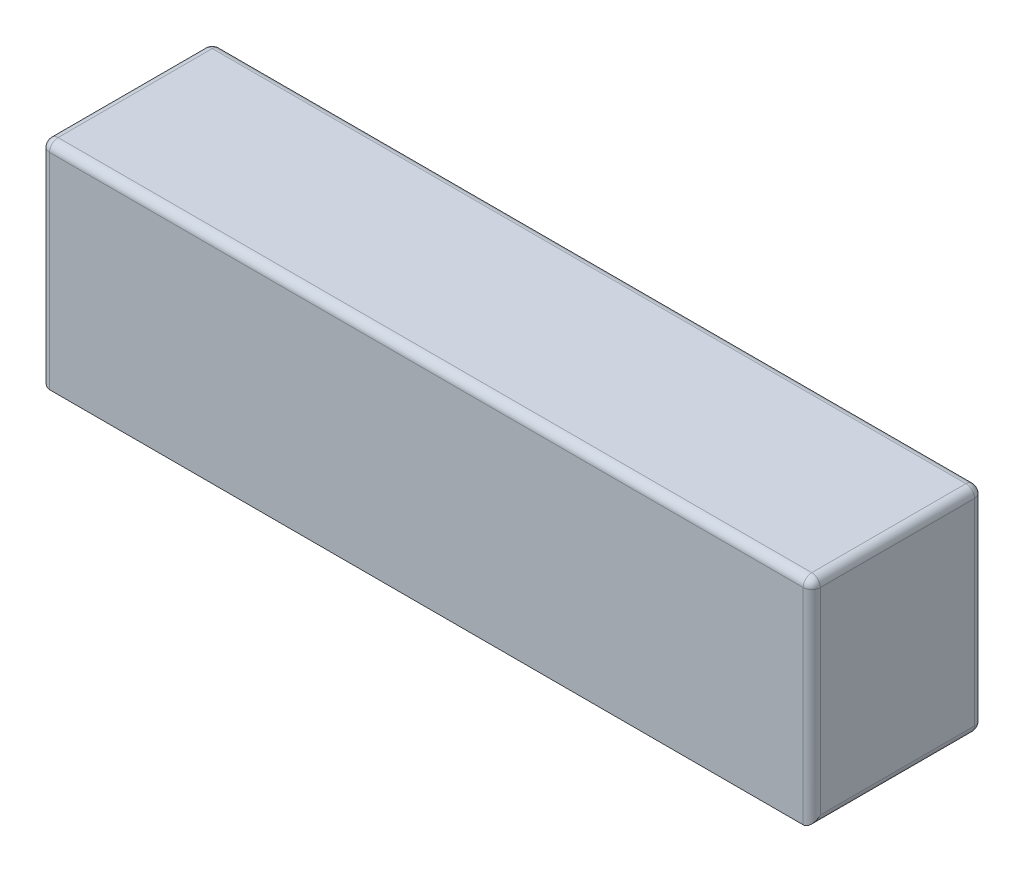
from build123d import *

# Parameters (mm, degrees)
SKETCH_1_W          = 90
SKETCH_1_H          = 25
EXTRUDE_1_DEPTH     = 20
SKETCH_4_W          = 42.246399656
SKETCH_4_H          = 21
CUT_EXTRUDE_2_DEPTH = 18
FILLET_5_R          = 1


with BuildPart() as part:
    # 草圖1 → 填料-伸長1 (new body)
    with BuildSketch(Plane.XY):
        with Locations((-36.268196215, -35.133707849)):
            Rectangle(SKETCH_1_W, SKETCH_1_H)
    extrude(amount=EXTRUDE_1_DEPTH)

    # 草圖4 → 除料-伸長2 (cut)
    with BuildSketch(Plane(origin=(0, 0, 0), x_dir=(-1, 0, 0), z_dir=(0, 0, -1))):
        with Locations((14.391396043, -35.133707849)):
            Rectangle(SKETCH_4_W, SKETCH_4_H)
        with Locations((58.144996387, -35.133707849)):
            Rectangle(SKETCH_4_W, SKETCH_4_H)
    extrude(amount=-CUT_EXTRUDE_2_DEPTH, mode=Mode.SUBTRACT)

    # 圓角5
    # the kernel refuses this fillet: 1 mm, written as the material it adds along each edge
    with BuildSketch(Plane(origin=(-78.268196215, -44.633707849, 17), x_dir=(-1, 0, 0), z_dir=(0, -1, 0))) as fillet_5_piece_1_section:
        Polygon((0, 0), (FILLET_5_R * 1.02, 0), (FILLET_5_R * 1.02, -FILLET_5_R * 1.02), (0, -FILLET_5_R * 1.02), align=None)
    fillet_5_piece_1 = extrude(amount=FILLET_5_R * 1.02, mode=Mode.PRIVATE)
    fillet_5_piece_1 = fillet_5_piece_1 - Plane(origin=(-78.268196215, -44.633707849, 17), x_dir=(0.7071067811865475, -1.914017473443079e-15, -0.7071067811865475), z_dir=(0, -1, 0)) * Sphere(FILLET_5_R, mode=Mode.PRIVATE)
    add(fillet_5_piece_1)
    with BuildSketch(Plane(origin=(6.731803785, -45.633707849, 0), x_dir=(-1, 0, 0), z_dir=(0, 0, 1)), Plane(origin=(-35.514595871, -24.633707849, 0), x_dir=(1, 0, 0), z_dir=(0, 0, 1)), Plane(origin=(-35.514595871, -45.633707849, 0), x_dir=(0, 1, 0), z_dir=(0, 0, 1)), Plane(origin=(-37.021796559, -45.633707849, 0), x_dir=(-1, 0, 0), z_dir=(0, 0, 1))) as fillet_5_piece_2:
        with BuildLine():
            CenterArc((FILLET_5_R, -FILLET_5_R), FILLET_5_R, 90, 90)
            Line((0, -FILLET_5_R), (-FILLET_5_R * 0.02, -FILLET_5_R))
            Line((-FILLET_5_R * 0.02, -FILLET_5_R), (-FILLET_5_R * 0.02, FILLET_5_R * 0.02))
            Line((-FILLET_5_R * 0.02, FILLET_5_R * 0.02), (FILLET_5_R, FILLET_5_R * 0.02))
            Line((FILLET_5_R, FILLET_5_R * 0.02), (FILLET_5_R, 0))
        make_face()
    extrude(amount=18)
    with BuildSketch(Plane(origin=(6.731803785, -24.633707849, 18), x_dir=(0, 0, -1), z_dir=(-1, 0, 0)), Plane(origin=(-35.514595871, -45.633707849, 18), x_dir=(0, 0, -1), z_dir=(1, 0, 0)), Plane(origin=(-37.021796559, -24.633707849, 18), x_dir=(0, 0, -1), z_dir=(-1, 0, 0))) as fillet_5_piece_3:
        with BuildLine():
            CenterArc((FILLET_5_R, FILLET_5_R), FILLET_5_R, 180, 90)
            Line((0, FILLET_5_R), (-FILLET_5_R * 0.02, FILLET_5_R))
            Line((-FILLET_5_R * 0.02, FILLET_5_R), (-FILLET_5_R * 0.02, -FILLET_5_R * 0.02))
            Line((-FILLET_5_R * 0.02, -FILLET_5_R * 0.02), (FILLET_5_R, -FILLET_5_R * 0.02))
            Line((FILLET_5_R, -FILLET_5_R * 0.02), (FILLET_5_R, 0))
        make_face()
    extrude(amount=42.246399656)
    with BuildSketch(Plane(origin=(6.731803785, -24.633707849, 0), x_dir=(-1, 0, 0), z_dir=(0, 0, 1))) as fillet_5_piece_4:
        with BuildLine():
            CenterArc((FILLET_5_R, FILLET_5_R), FILLET_5_R, 180, 90)
            Line((0, FILLET_5_R), (-FILLET_5_R * 0.02, FILLET_5_R))
            Line((-FILLET_5_R * 0.02, FILLET_5_R), (-FILLET_5_R * 0.02, -FILLET_5_R * 0.02))
            Line((-FILLET_5_R * 0.02, -FILLET_5_R * 0.02), (FILLET_5_R, -FILLET_5_R * 0.02))
            Line((FILLET_5_R, -FILLET_5_R * 0.02), (FILLET_5_R, 0))
        make_face()
    extrude(amount=18)
    with BuildSketch(Plane(origin=(-79.268196215, -24.633707849, 18), x_dir=(0, 0, -1), z_dir=(0, -1, 0))) as fillet_5_piece_5:
        with BuildLine():
            CenterArc((FILLET_5_R, FILLET_5_R), FILLET_5_R, 180, 90)
            Line((0, FILLET_5_R), (-FILLET_5_R * 0.02, FILLET_5_R))
            Line((-FILLET_5_R * 0.02, FILLET_5_R), (-FILLET_5_R * 0.02, -FILLET_5_R * 0.02))
            Line((-FILLET_5_R * 0.02, -FILLET_5_R * 0.02), (FILLET_5_R, -FILLET_5_R * 0.02))
            Line((FILLET_5_R, -FILLET_5_R * 0.02), (FILLET_5_R, 0))
        make_face()
    extrude(amount=20)
    with BuildSketch(Plane(origin=(-78.268196215, -45.633707849, 18), x_dir=(0, 0, -1), z_dir=(1, 0, 0))) as fillet_5_piece_6:
        with BuildLine():
            CenterArc((FILLET_5_R, FILLET_5_R), FILLET_5_R, 180, 90)
            Line((0, FILLET_5_R), (-FILLET_5_R * 0.02, FILLET_5_R))
            Line((-FILLET_5_R * 0.02, FILLET_5_R), (-FILLET_5_R * 0.02, -FILLET_5_R * 0.02))
            Line((-FILLET_5_R * 0.02, -FILLET_5_R * 0.02), (FILLET_5_R, -FILLET_5_R * 0.02))
            Line((FILLET_5_R, -FILLET_5_R * 0.02), (FILLET_5_R, 0))
        make_face()
    extrude(amount=41.246399656)
    with BuildSketch(Plane(origin=(-79.268196215, -45.633707849, 0), x_dir=(1, 0, 0), z_dir=(0, 0, 1))) as fillet_5_piece_7:
        with BuildLine():
            CenterArc((FILLET_5_R, FILLET_5_R), FILLET_5_R, 180, 90)
            Line((0, FILLET_5_R), (-FILLET_5_R * 0.02, FILLET_5_R))
            Line((-FILLET_5_R * 0.02, FILLET_5_R), (-FILLET_5_R * 0.02, -FILLET_5_R * 0.02))
            Line((-FILLET_5_R * 0.02, -FILLET_5_R * 0.02), (FILLET_5_R, -FILLET_5_R * 0.02))
            Line((FILLET_5_R, -FILLET_5_R * 0.02), (FILLET_5_R, 0))
        make_face()
    extrude(amount=17)
    with BuildSketch(Plane(origin=(6.731803785, -45.633707849, 0), x_dir=(-1, 0, 0), z_dir=(0, 0, 1))) as fillet_5_piece_8a_section:
        with BuildLine():
            CenterArc((FILLET_5_R, -FILLET_5_R), FILLET_5_R, 90, 90)
            Line((0, -FILLET_5_R), (-FILLET_5_R * 0.02, -FILLET_5_R))
            Line((-FILLET_5_R * 0.02, -FILLET_5_R), (-FILLET_5_R * 0.02, FILLET_5_R * 0.02))
            Line((-FILLET_5_R * 0.02, FILLET_5_R * 0.02), (FILLET_5_R, FILLET_5_R * 0.02))
            Line((FILLET_5_R, FILLET_5_R * 0.02), (FILLET_5_R, 0))
        make_face()
    fillet_5_piece_8a = extrude(amount=20.5, mode=Mode.PRIVATE)
    fillet_5_piece_8a = split(fillet_5_piece_8a, bisect_by=Plane(origin=(6.505408671, -45.407312734, 18), z_dir=(0, 0, 1)), keep=Keep.TOP, mode=Mode.PRIVATE)
    with BuildSketch(Plane(origin=(-35.514595871, -45.633707849, 18), x_dir=(0, 0, -1), z_dir=(1, 0, 0))) as fillet_5_piece_8b_section:
        with BuildLine():
            CenterArc((FILLET_5_R, FILLET_5_R), FILLET_5_R, 180, 90)
            Line((0, FILLET_5_R), (-FILLET_5_R * 0.02, FILLET_5_R))
            Line((-FILLET_5_R * 0.02, FILLET_5_R), (-FILLET_5_R * 0.02, -FILLET_5_R * 0.02))
            Line((-FILLET_5_R * 0.02, -FILLET_5_R * 0.02), (FILLET_5_R, -FILLET_5_R * 0.02))
            Line((FILLET_5_R, -FILLET_5_R * 0.02), (FILLET_5_R, 0))
        make_face()
    fillet_5_piece_8b = extrude(amount=44.746399656, mode=Mode.PRIVATE)
    fillet_5_piece_8b = split(fillet_5_piece_8b, bisect_by=Plane(origin=(6.731803785, -45.407312734, 17.773604886), z_dir=(1, 0, 0)), keep=Keep.TOP, mode=Mode.PRIVATE)
    fillet_5_piece_8 = fillet_5_piece_8a & fillet_5_piece_8b
    add(fillet_5_piece_8)
    with BuildSketch(Plane(origin=(6.731803785, -24.633707849, 0), x_dir=(-1, 0, 0), z_dir=(0, 0, 1))) as fillet_5_piece_9a_section:
        with BuildLine():
            CenterArc((FILLET_5_R, FILLET_5_R), FILLET_5_R, 180, 90)
            Line((0, FILLET_5_R), (-FILLET_5_R * 0.02, FILLET_5_R))
            Line((-FILLET_5_R * 0.02, FILLET_5_R), (-FILLET_5_R * 0.02, -FILLET_5_R * 0.02))
            Line((-FILLET_5_R * 0.02, -FILLET_5_R * 0.02), (FILLET_5_R, -FILLET_5_R * 0.02))
            Line((FILLET_5_R, -FILLET_5_R * 0.02), (FILLET_5_R, 0))
        make_face()
    fillet_5_piece_9a = extrude(amount=20.5, mode=Mode.PRIVATE)
    fillet_5_piece_9a = split(fillet_5_piece_9a, bisect_by=Plane(origin=(6.505408671, -24.860102963, 18), z_dir=(0, 0, 1)), keep=Keep.TOP, mode=Mode.PRIVATE)
    with BuildSketch(Plane(origin=(9.231803785, -24.633707849, 18), x_dir=(0, 0, -1), z_dir=(-1, 0, 0))) as fillet_5_piece_9b_section:
        with BuildLine():
            CenterArc((FILLET_5_R, FILLET_5_R), FILLET_5_R, 180, 90)
            Line((0, FILLET_5_R), (-FILLET_5_R * 0.02, FILLET_5_R))
            Line((-FILLET_5_R * 0.02, FILLET_5_R), (-FILLET_5_R * 0.02, -FILLET_5_R * 0.02))
            Line((-FILLET_5_R * 0.02, -FILLET_5_R * 0.02), (FILLET_5_R, -FILLET_5_R * 0.02))
            Line((FILLET_5_R, -FILLET_5_R * 0.02), (FILLET_5_R, 0))
        make_face()
    fillet_5_piece_9b = extrude(amount=44.746399656, mode=Mode.PRIVATE)
    fillet_5_piece_9b = split(fillet_5_piece_9b, bisect_by=Plane(origin=(6.731803785, -24.860102963, 17.773604886), z_dir=(1, 0, 0)), keep=Keep.TOP, mode=Mode.PRIVATE)
    fillet_5_piece_9 = fillet_5_piece_9a & fillet_5_piece_9b
    add(fillet_5_piece_9)
    with BuildSketch(Plane(origin=(-35.514595871, -24.633707849, 0), x_dir=(1, 0, 0), z_dir=(0, 0, 1))) as fillet_5_piece_10a_section:
        with BuildLine():
            CenterArc((FILLET_5_R, -FILLET_5_R), FILLET_5_R, 90, 90)
            Line((0, -FILLET_5_R), (-FILLET_5_R * 0.02, -FILLET_5_R))
            Line((-FILLET_5_R * 0.02, -FILLET_5_R), (-FILLET_5_R * 0.02, FILLET_5_R * 0.02))
            Line((-FILLET_5_R * 0.02, FILLET_5_R * 0.02), (FILLET_5_R, FILLET_5_R * 0.02))
            Line((FILLET_5_R, FILLET_5_R * 0.02), (FILLET_5_R, 0))
        make_face()
    fillet_5_piece_10a = extrude(amount=20.5, mode=Mode.PRIVATE)
    fillet_5_piece_10a = split(fillet_5_piece_10a, bisect_by=Plane(origin=(-35.288200757, -24.860102963, 18), z_dir=(0, 0, 1)), keep=Keep.TOP, mode=Mode.PRIVATE)
    with BuildSketch(Plane(origin=(6.731803785, -24.633707849, 18), x_dir=(0, 0, -1), z_dir=(-1, 0, 0))) as fillet_5_piece_10b_section:
        with BuildLine():
            CenterArc((FILLET_5_R, FILLET_5_R), FILLET_5_R, 180, 90)
            Line((0, FILLET_5_R), (-FILLET_5_R * 0.02, FILLET_5_R))
            Line((-FILLET_5_R * 0.02, FILLET_5_R), (-FILLET_5_R * 0.02, -FILLET_5_R * 0.02))
            Line((-FILLET_5_R * 0.02, -FILLET_5_R * 0.02), (FILLET_5_R, -FILLET_5_R * 0.02))
            Line((FILLET_5_R, -FILLET_5_R * 0.02), (FILLET_5_R, 0))
        make_face()
    fillet_5_piece_10b = extrude(amount=44.746399656, mode=Mode.PRIVATE)
    fillet_5_piece_10b = split(fillet_5_piece_10b, bisect_by=Plane(origin=(-35.514595871, -24.860102963, 17.773604886), z_dir=(-1, 0, 0)), keep=Keep.TOP, mode=Mode.PRIVATE)
    fillet_5_piece_10 = fillet_5_piece_10a & fillet_5_piece_10b
    add(fillet_5_piece_10)
    with BuildSketch(Plane(origin=(-35.514595871, -45.633707849, 0), x_dir=(0, 1, 0), z_dir=(0, 0, 1))) as fillet_5_piece_11a_section:
        with BuildLine():
            CenterArc((FILLET_5_R, -FILLET_5_R), FILLET_5_R, 90, 90)
            Line((0, -FILLET_5_R), (-FILLET_5_R * 0.02, -FILLET_5_R))
            Line((-FILLET_5_R * 0.02, -FILLET_5_R), (-FILLET_5_R * 0.02, FILLET_5_R * 0.02))
            Line((-FILLET_5_R * 0.02, FILLET_5_R * 0.02), (FILLET_5_R, FILLET_5_R * 0.02))
            Line((FILLET_5_R, FILLET_5_R * 0.02), (FILLET_5_R, 0))
        make_face()
    fillet_5_piece_11a = extrude(amount=20.5, mode=Mode.PRIVATE)
    fillet_5_piece_11a = split(fillet_5_piece_11a, bisect_by=Plane(origin=(-35.288200757, -45.407312734, 18), z_dir=(0, 0, 1)), keep=Keep.TOP, mode=Mode.PRIVATE)
    with BuildSketch(Plane(origin=(-38.014595871, -45.633707849, 18), x_dir=(0, 0, -1), z_dir=(1, 0, 0))) as fillet_5_piece_11b_section:
        with BuildLine():
            CenterArc((FILLET_5_R, FILLET_5_R), FILLET_5_R, 180, 90)
            Line((0, FILLET_5_R), (-FILLET_5_R * 0.02, FILLET_5_R))
            Line((-FILLET_5_R * 0.02, FILLET_5_R), (-FILLET_5_R * 0.02, -FILLET_5_R * 0.02))
            Line((-FILLET_5_R * 0.02, -FILLET_5_R * 0.02), (FILLET_5_R, -FILLET_5_R * 0.02))
            Line((FILLET_5_R, -FILLET_5_R * 0.02), (FILLET_5_R, 0))
        make_face()
    fillet_5_piece_11b = extrude(amount=44.746399656, mode=Mode.PRIVATE)
    fillet_5_piece_11b = split(fillet_5_piece_11b, bisect_by=Plane(origin=(-35.514595871, -45.407312734, 17.773604886), z_dir=(-1, 0, 0)), keep=Keep.TOP, mode=Mode.PRIVATE)
    fillet_5_piece_11 = fillet_5_piece_11a & fillet_5_piece_11b
    add(fillet_5_piece_11)
    with BuildSketch(Plane(origin=(-37.021796559, -24.633707849, 18), x_dir=(0, 0, -1), z_dir=(-1, 0, 0))) as fillet_5_piece_12a_section:
        with BuildLine():
            CenterArc((FILLET_5_R, FILLET_5_R), FILLET_5_R, 180, 90)
            Line((0, FILLET_5_R), (-FILLET_5_R * 0.02, FILLET_5_R))
            Line((-FILLET_5_R * 0.02, FILLET_5_R), (-FILLET_5_R * 0.02, -FILLET_5_R * 0.02))
            Line((-FILLET_5_R * 0.02, -FILLET_5_R * 0.02), (FILLET_5_R, -FILLET_5_R * 0.02))
            Line((FILLET_5_R, -FILLET_5_R * 0.02), (FILLET_5_R, 0))
        make_face()
    fillet_5_piece_12a = extrude(amount=44.746399656, mode=Mode.PRIVATE)
    fillet_5_piece_12a = split(fillet_5_piece_12a, bisect_by=Plane(origin=(-79.268196215, -24.860102963, 17.773604886), z_dir=(-1, 0, 0)), keep=Keep.TOP, mode=Mode.PRIVATE)
    with BuildSketch(Plane(origin=(-79.268196215, -22.133707849, 18), x_dir=(0, 0, -1), z_dir=(0, -1, 0))) as fillet_5_piece_12b_section:
        with BuildLine():
            CenterArc((FILLET_5_R, FILLET_5_R), FILLET_5_R, 180, 90)
            Line((0, FILLET_5_R), (-FILLET_5_R * 0.02, FILLET_5_R))
            Line((-FILLET_5_R * 0.02, FILLET_5_R), (-FILLET_5_R * 0.02, -FILLET_5_R * 0.02))
            Line((-FILLET_5_R * 0.02, -FILLET_5_R * 0.02), (FILLET_5_R, -FILLET_5_R * 0.02))
            Line((FILLET_5_R, -FILLET_5_R * 0.02), (FILLET_5_R, 0))
        make_face()
    fillet_5_piece_12b = extrude(amount=22.5, mode=Mode.PRIVATE)
    fillet_5_piece_12b = split(fillet_5_piece_12b, bisect_by=Plane(origin=(-79.041801101, -24.633707849, 17.773604886), z_dir=(0, 1, 0)), keep=Keep.TOP, mode=Mode.PRIVATE)
    fillet_5_piece_12 = fillet_5_piece_12a & fillet_5_piece_12b
    add(fillet_5_piece_12)
    with BuildSketch(Plane(origin=(-37.021796559, -45.633707849, 0), x_dir=(-1, 0, 0), z_dir=(0, 0, 1))) as fillet_5_piece_13a_section:
        with BuildLine():
            CenterArc((FILLET_5_R, -FILLET_5_R), FILLET_5_R, 90, 90)
            Line((0, -FILLET_5_R), (-FILLET_5_R * 0.02, -FILLET_5_R))
            Line((-FILLET_5_R * 0.02, -FILLET_5_R), (-FILLET_5_R * 0.02, FILLET_5_R * 0.02))
            Line((-FILLET_5_R * 0.02, FILLET_5_R * 0.02), (FILLET_5_R, FILLET_5_R * 0.02))
            Line((FILLET_5_R, FILLET_5_R * 0.02), (FILLET_5_R, 0))
        make_face()
    fillet_5_piece_13a = extrude(amount=20.5, mode=Mode.PRIVATE)
    fillet_5_piece_13a = split(fillet_5_piece_13a, bisect_by=Plane(origin=(-37.248191673, -45.407312734, 18), z_dir=(0, 0, 1)), keep=Keep.TOP, mode=Mode.PRIVATE)
    with BuildSketch(Plane(origin=(-78.268196215, -45.633707849, 18), x_dir=(0, 0, -1), z_dir=(1, 0, 0))) as fillet_5_piece_13b_section:
        with BuildLine():
            CenterArc((FILLET_5_R, FILLET_5_R), FILLET_5_R, 180, 90)
            Line((0, FILLET_5_R), (-FILLET_5_R * 0.02, FILLET_5_R))
            Line((-FILLET_5_R * 0.02, FILLET_5_R), (-FILLET_5_R * 0.02, -FILLET_5_R * 0.02))
            Line((-FILLET_5_R * 0.02, -FILLET_5_R * 0.02), (FILLET_5_R, -FILLET_5_R * 0.02))
            Line((FILLET_5_R, -FILLET_5_R * 0.02), (FILLET_5_R, 0))
        make_face()
    fillet_5_piece_13b = extrude(amount=43.746399656, mode=Mode.PRIVATE)
    fillet_5_piece_13b = split(fillet_5_piece_13b, bisect_by=Plane(origin=(-37.021796559, -45.407312734, 17.773604886), z_dir=(1, 0, 0)), keep=Keep.TOP, mode=Mode.PRIVATE)
    fillet_5_piece_13 = fillet_5_piece_13a & fillet_5_piece_13b
    add(fillet_5_piece_13)
    # the kernel refuses this fillet: 1 mm, written as the material it takes off along each edge
    with BuildSketch(Plane(origin=(-80.268196215, -23.633707849, 19), x_dir=(-1, 0, 0), z_dir=(0, 1, 0))) as fillet_5_2_piece_1_section:
        Polygon((0, 0), (FILLET_5_R * 1.02, 0), (FILLET_5_R * 1.02, FILLET_5_R * 1.02), (0, FILLET_5_R * 1.02), align=None)
    fillet_5_2_piece_1 = extrude(amount=FILLET_5_R * 1.02, mode=Mode.PRIVATE)
    fillet_5_2_piece_1 = fillet_5_2_piece_1 - Plane(origin=(-80.268196215, -23.633707849, 19), x_dir=(0.7071067811865475, 0, -0.7071067811865475), z_dir=(0, 1, 0)) * Sphere(FILLET_5_R, mode=Mode.PRIVATE)
    add(fillet_5_2_piece_1, mode=Mode.SUBTRACT)
    with BuildSketch(Plane(origin=(7.731803785, -23.633707849, 19), x_dir=(1, 0, 0), z_dir=(0, 1, 0))) as fillet_5_2_piece_2_section:
        Polygon((0, 0), (FILLET_5_R * 1.02, 0), (FILLET_5_R * 1.02, -FILLET_5_R * 1.02), (0, -FILLET_5_R * 1.02), align=None)
    fillet_5_2_piece_2 = extrude(amount=FILLET_5_R * 1.02, mode=Mode.PRIVATE)
    fillet_5_2_piece_2 = fillet_5_2_piece_2 - Plane(origin=(7.731803785, -23.633707849, 19), x_dir=(-0.7071067811865475, 0, -0.7071067811865475), z_dir=(0, 1, 0)) * Sphere(FILLET_5_R, mode=Mode.PRIVATE)
    add(fillet_5_2_piece_2, mode=Mode.SUBTRACT)
    with BuildSketch(Plane(origin=(7.731803785, -46.633707849, 1), x_dir=(0, 0, -1), z_dir=(1, 0, 0))) as fillet_5_2_piece_3_section:
        Polygon((0, 0), (FILLET_5_R * 1.02, 0), (FILLET_5_R * 1.02, -FILLET_5_R * 1.02), (0, -FILLET_5_R * 1.02), align=None)
    fillet_5_2_piece_3 = extrude(amount=FILLET_5_R * 1.02, mode=Mode.PRIVATE)
    fillet_5_2_piece_3 = fillet_5_2_piece_3 - Plane(origin=(7.731803785, -46.633707849, 1), x_dir=(0, 0.7071067811865475, 0.7071067811865475), z_dir=(1, 0, 0)) * Sphere(FILLET_5_R, mode=Mode.PRIVATE)
    add(fillet_5_2_piece_3, mode=Mode.SUBTRACT)
    with BuildSketch(Plane(origin=(7.731803785, -23.633707849, 1), x_dir=(1, 0, 0), z_dir=(0, 1, 0))) as fillet_5_2_piece_4_section:
        Polygon((0, 0), (FILLET_5_R * 1.02, 0), (FILLET_5_R * 1.02, FILLET_5_R * 1.02), (0, FILLET_5_R * 1.02), align=None)
    fillet_5_2_piece_4 = extrude(amount=FILLET_5_R * 1.02, mode=Mode.PRIVATE)
    fillet_5_2_piece_4 = fillet_5_2_piece_4 - Plane(origin=(7.731803785, -23.633707849, 1), x_dir=(-0.7071067811865475, 0, 0.7071067811865475), z_dir=(0, 1, 0)) * Sphere(FILLET_5_R, mode=Mode.PRIVATE)
    add(fillet_5_2_piece_4, mode=Mode.SUBTRACT)
    with BuildSketch(Plane(origin=(-80.268196215, -46.633707849, 1), x_dir=(0, 0, -1), z_dir=(-1, 0, 0))) as fillet_5_2_piece_5_section:
        Polygon((0, 0), (FILLET_5_R * 1.02, 0), (FILLET_5_R * 1.02, FILLET_5_R * 1.02), (0, FILLET_5_R * 1.02), align=None)
    fillet_5_2_piece_5 = extrude(amount=FILLET_5_R * 1.02, mode=Mode.PRIVATE)
    fillet_5_2_piece_5 = fillet_5_2_piece_5 - Plane(origin=(-80.268196215, -46.633707849, 1), x_dir=(0, 0.7071067811865475, 0.7071067811865475), z_dir=(-1, 0, 0)) * Sphere(FILLET_5_R, mode=Mode.PRIVATE)
    add(fillet_5_2_piece_5, mode=Mode.SUBTRACT)
    with BuildSketch(Plane(origin=(-80.268196215, -23.633707849, 1), x_dir=(-1, 0, 0), z_dir=(0, 1, 0))) as fillet_5_2_piece_6_section:
        Polygon((0, 0), (FILLET_5_R * 1.02, 0), (FILLET_5_R * 1.02, -FILLET_5_R * 1.02), (0, -FILLET_5_R * 1.02), align=None)
    fillet_5_2_piece_6 = extrude(amount=FILLET_5_R * 1.02, mode=Mode.PRIVATE)
    fillet_5_2_piece_6 = fillet_5_2_piece_6 - Plane(origin=(-80.268196215, -23.633707849, 1), x_dir=(0.7071067811865475, 0, 0.7071067811865475), z_dir=(0, 1, 0)) * Sphere(FILLET_5_R, mode=Mode.PRIVATE)
    add(fillet_5_2_piece_6, mode=Mode.SUBTRACT)
    with BuildSketch(Plane(origin=(-81.268196215, -23.633707849, 20), x_dir=(0, 0, -1), z_dir=(0, -1, 0)), Plane(origin=(8.731803785, -47.633707849, 20), x_dir=(0, 0, -1), z_dir=(0, 1, 0))) as fillet_5_2_piece_7:
        with BuildLine():
            CenterArc((FILLET_5_R, FILLET_5_R), FILLET_5_R, 180, 90)
            Line((0, FILLET_5_R), (-FILLET_5_R * 0.02, FILLET_5_R))
            Line((-FILLET_5_R * 0.02, FILLET_5_R), (-FILLET_5_R * 0.02, -FILLET_5_R * 0.02))
            Line((-FILLET_5_R * 0.02, -FILLET_5_R * 0.02), (FILLET_5_R, -FILLET_5_R * 0.02))
            Line((FILLET_5_R, -FILLET_5_R * 0.02), (FILLET_5_R, 0))
        make_face()
    extrude(amount=24, mode=Mode.SUBTRACT)
    with BuildSketch(Plane(origin=(-37.021796559, -24.633707849, 0), x_dir=(0, 1, 0), z_dir=(-1, 0, 0))) as fillet_5_2_piece_8:
        with BuildLine():
            CenterArc((FILLET_5_R, -FILLET_5_R), FILLET_5_R, 90, 90)
            Line((0, -FILLET_5_R), (-FILLET_5_R * 0.02, -FILLET_5_R))
            Line((-FILLET_5_R * 0.02, -FILLET_5_R), (-FILLET_5_R * 0.02, FILLET_5_R * 0.02))
            Line((-FILLET_5_R * 0.02, FILLET_5_R * 0.02), (FILLET_5_R, FILLET_5_R * 0.02))
            Line((FILLET_5_R, FILLET_5_R * 0.02), (FILLET_5_R, 0))
        make_face()
    extrude(amount=42.246399656, mode=Mode.SUBTRACT)
    with BuildSketch(Plane(origin=(8.731803785, -46.633707849, 0), x_dir=(0, 0, 1), z_dir=(0, 1, 0)), Plane(origin=(-81.268196215, -23.633707849, 0), x_dir=(0, 0, 1), z_dir=(0, -1, 0))) as fillet_5_2_piece_9:
        with BuildLine():
            CenterArc((FILLET_5_R, -FILLET_5_R), FILLET_5_R, 90, 90)
            Line((0, -FILLET_5_R), (-FILLET_5_R * 0.02, -FILLET_5_R))
            Line((-FILLET_5_R * 0.02, -FILLET_5_R), (-FILLET_5_R * 0.02, FILLET_5_R * 0.02))
            Line((-FILLET_5_R * 0.02, FILLET_5_R * 0.02), (FILLET_5_R, FILLET_5_R * 0.02))
            Line((FILLET_5_R, FILLET_5_R * 0.02), (FILLET_5_R, 0))
        make_face()
    extrude(amount=23, mode=Mode.SUBTRACT)
    with BuildSketch(Plane(origin=(7.731803785, -22.633707849, 20), x_dir=(0, 0, -1), z_dir=(-1, 0, 0)), Plane(origin=(-80.268196215, -47.633707849, 0), x_dir=(0, 1, 0), z_dir=(1, 0, 0))) as fillet_5_2_piece_10:
        with BuildLine():
            CenterArc((FILLET_5_R, FILLET_5_R), FILLET_5_R, 180, 90)
            Line((0, FILLET_5_R), (-FILLET_5_R * 0.02, FILLET_5_R))
            Line((-FILLET_5_R * 0.02, FILLET_5_R), (-FILLET_5_R * 0.02, -FILLET_5_R * 0.02))
            Line((-FILLET_5_R * 0.02, -FILLET_5_R * 0.02), (FILLET_5_R, -FILLET_5_R * 0.02))
            Line((FILLET_5_R, -FILLET_5_R * 0.02), (FILLET_5_R, 0))
        make_face()
    extrude(amount=88, mode=Mode.SUBTRACT)
    with BuildSketch(Plane(origin=(7.731803785, -22.633707849, 0), x_dir=(0, 0, 1), z_dir=(-1, 0, 0))) as fillet_5_2_piece_11:
        with BuildLine():
            CenterArc((FILLET_5_R, -FILLET_5_R), FILLET_5_R, 90, 90)
            Line((0, -FILLET_5_R), (-FILLET_5_R * 0.02, -FILLET_5_R))
            Line((-FILLET_5_R * 0.02, -FILLET_5_R), (-FILLET_5_R * 0.02, FILLET_5_R * 0.02))
            Line((-FILLET_5_R * 0.02, FILLET_5_R * 0.02), (FILLET_5_R, FILLET_5_R * 0.02))
            Line((FILLET_5_R, FILLET_5_R * 0.02), (FILLET_5_R, 0))
        make_face()
    extrude(amount=88, mode=Mode.SUBTRACT)
    with BuildSketch(Plane(origin=(8.731803785, -22.633707849, 1), x_dir=(-1, 0, 0), z_dir=(0, 0, 1))) as fillet_5_2_piece_12:
        with BuildLine():
            CenterArc((FILLET_5_R, FILLET_5_R), FILLET_5_R, 180, 90)
            Line((0, FILLET_5_R), (-FILLET_5_R * 0.02, FILLET_5_R))
            Line((-FILLET_5_R * 0.02, FILLET_5_R), (-FILLET_5_R * 0.02, -FILLET_5_R * 0.02))
            Line((-FILLET_5_R * 0.02, -FILLET_5_R * 0.02), (FILLET_5_R, -FILLET_5_R * 0.02))
            Line((FILLET_5_R, -FILLET_5_R * 0.02), (FILLET_5_R, 0))
        make_face()
    extrude(amount=18, mode=Mode.SUBTRACT)
    with BuildSketch(Plane(origin=(8.731803785, -47.633707849, 1), x_dir=(0, 1, 0), z_dir=(0, 0, 1))) as fillet_5_2_piece_13:
        with BuildLine():
            CenterArc((FILLET_5_R, FILLET_5_R), FILLET_5_R, 180, 90)
            Line((0, FILLET_5_R), (-FILLET_5_R * 0.02, FILLET_5_R))
            Line((-FILLET_5_R * 0.02, FILLET_5_R), (-FILLET_5_R * 0.02, -FILLET_5_R * 0.02))
            Line((-FILLET_5_R * 0.02, -FILLET_5_R * 0.02), (FILLET_5_R, -FILLET_5_R * 0.02))
            Line((FILLET_5_R, -FILLET_5_R * 0.02), (FILLET_5_R, 0))
        make_face()
    extrude(amount=19, mode=Mode.SUBTRACT)
    with BuildSketch(Plane(origin=(-81.268196215, -47.633707849, 1), x_dir=(0, 1, 0), z_dir=(0, 0, 1))) as fillet_5_2_piece_14:
        with BuildLine():
            CenterArc((FILLET_5_R, -FILLET_5_R), FILLET_5_R, 90, 90)
            Line((0, -FILLET_5_R), (-FILLET_5_R * 0.02, -FILLET_5_R))
            Line((-FILLET_5_R * 0.02, -FILLET_5_R), (-FILLET_5_R * 0.02, FILLET_5_R * 0.02))
            Line((-FILLET_5_R * 0.02, FILLET_5_R * 0.02), (FILLET_5_R, FILLET_5_R * 0.02))
            Line((FILLET_5_R, FILLET_5_R * 0.02), (FILLET_5_R, 0))
        make_face()
    extrude(amount=19, mode=Mode.SUBTRACT)
    with BuildSketch(Plane(origin=(-81.268196215, -22.633707849, 1), x_dir=(1, 0, 0), z_dir=(0, 0, 1))) as fillet_5_2_piece_15:
        with BuildLine():
            CenterArc((FILLET_5_R, -FILLET_5_R), FILLET_5_R, 90, 90)
            Line((0, -FILLET_5_R), (-FILLET_5_R * 0.02, -FILLET_5_R))
            Line((-FILLET_5_R * 0.02, -FILLET_5_R), (-FILLET_5_R * 0.02, FILLET_5_R * 0.02))
            Line((-FILLET_5_R * 0.02, FILLET_5_R * 0.02), (FILLET_5_R, FILLET_5_R * 0.02))
            Line((FILLET_5_R, FILLET_5_R * 0.02), (FILLET_5_R, 0))
        make_face()
    extrude(amount=18, mode=Mode.SUBTRACT)
    with BuildSketch(Plane(origin=(-81.268196215, -47.633707849, 1), x_dir=(0, 1, 0), z_dir=(0, 0, 1))) as fillet_5_2_piece_16a_section:
        with BuildLine():
            CenterArc((FILLET_5_R, -FILLET_5_R), FILLET_5_R, 90, 90)
            Line((0, -FILLET_5_R), (-FILLET_5_R * 0.02, -FILLET_5_R))
            Line((-FILLET_5_R * 0.02, -FILLET_5_R), (-FILLET_5_R * 0.02, FILLET_5_R * 0.02))
            Line((-FILLET_5_R * 0.02, FILLET_5_R * 0.02), (FILLET_5_R, FILLET_5_R * 0.02))
            Line((FILLET_5_R, FILLET_5_R * 0.02), (FILLET_5_R, 0))
        make_face()
    fillet_5_2_piece_16a = extrude(amount=21.5, mode=Mode.PRIVATE)
    fillet_5_2_piece_16a = split(fillet_5_2_piece_16a, bisect_by=Plane(origin=(-81.041801101, -47.407312734, 20), z_dir=(0, 0, 1)), keep=Keep.TOP, mode=Mode.PRIVATE)
    with BuildSketch(Plane(origin=(-81.268196215, -23.633707849, 20), x_dir=(0, 0, -1), z_dir=(0, -1, 0))) as fillet_5_2_piece_16b_section:
        with BuildLine():
            CenterArc((FILLET_5_R, FILLET_5_R), FILLET_5_R, 180, 90)
            Line((0, FILLET_5_R), (-FILLET_5_R * 0.02, FILLET_5_R))
            Line((-FILLET_5_R * 0.02, FILLET_5_R), (-FILLET_5_R * 0.02, -FILLET_5_R * 0.02))
            Line((-FILLET_5_R * 0.02, -FILLET_5_R * 0.02), (FILLET_5_R, -FILLET_5_R * 0.02))
            Line((FILLET_5_R, -FILLET_5_R * 0.02), (FILLET_5_R, 0))
        make_face()
    fillet_5_2_piece_16b = extrude(amount=26.5, mode=Mode.PRIVATE)
    fillet_5_2_piece_16b = split(fillet_5_2_piece_16b, bisect_by=Plane(origin=(-81.041801101, -47.633707849, 19.773604886), z_dir=(0, -1, 0)), keep=Keep.TOP, mode=Mode.PRIVATE)
    fillet_5_2_piece_16 = fillet_5_2_piece_16a & fillet_5_2_piece_16b
    add(fillet_5_2_piece_16, mode=Mode.SUBTRACT)
    with BuildSketch(Plane(origin=(8.731803785, -47.633707849, 1), x_dir=(0, 1, 0), z_dir=(0, 0, 1))) as fillet_5_2_piece_17a_section:
        with BuildLine():
            CenterArc((FILLET_5_R, FILLET_5_R), FILLET_5_R, 180, 90)
            Line((0, FILLET_5_R), (-FILLET_5_R * 0.02, FILLET_5_R))
            Line((-FILLET_5_R * 0.02, FILLET_5_R), (-FILLET_5_R * 0.02, -FILLET_5_R * 0.02))
            Line((-FILLET_5_R * 0.02, -FILLET_5_R * 0.02), (FILLET_5_R, -FILLET_5_R * 0.02))
            Line((FILLET_5_R, -FILLET_5_R * 0.02), (FILLET_5_R, 0))
        make_face()
    fillet_5_2_piece_17a = extrude(amount=21.5, mode=Mode.PRIVATE)
    fillet_5_2_piece_17a = split(fillet_5_2_piece_17a, bisect_by=Plane(origin=(8.505408671, -47.407312734, 20), z_dir=(0, 0, 1)), keep=Keep.TOP, mode=Mode.PRIVATE)
    with BuildSketch(Plane(origin=(8.731803785, -50.133707849, 20), x_dir=(0, 0, -1), z_dir=(0, 1, 0))) as fillet_5_2_piece_17b_section:
        with BuildLine():
            CenterArc((FILLET_5_R, FILLET_5_R), FILLET_5_R, 180, 90)
            Line((0, FILLET_5_R), (-FILLET_5_R * 0.02, FILLET_5_R))
            Line((-FILLET_5_R * 0.02, FILLET_5_R), (-FILLET_5_R * 0.02, -FILLET_5_R * 0.02))
            Line((-FILLET_5_R * 0.02, -FILLET_5_R * 0.02), (FILLET_5_R, -FILLET_5_R * 0.02))
            Line((FILLET_5_R, -FILLET_5_R * 0.02), (FILLET_5_R, 0))
        make_face()
    fillet_5_2_piece_17b = extrude(amount=26.5, mode=Mode.PRIVATE)
    fillet_5_2_piece_17b = split(fillet_5_2_piece_17b, bisect_by=Plane(origin=(8.505408671, -47.633707849, 19.773604886), z_dir=(0, -1, 0)), keep=Keep.TOP, mode=Mode.PRIVATE)
    fillet_5_2_piece_17 = fillet_5_2_piece_17a & fillet_5_2_piece_17b
    add(fillet_5_2_piece_17, mode=Mode.SUBTRACT)
    # the kernel refuses this fillet: 1 mm, written as the material it takes off along each edge
    with BuildSketch(Plane(origin=(6.731803785, -44.633707849, 0), x_dir=(1, 0, 0), z_dir=(0, 1, 0)), Plane(origin=(-35.514595871, -25.633707849, 0), x_dir=(-1, 0, 0), z_dir=(0, -1, 0))) as fillet_5_3_piece_1:
        with BuildLine():
            CenterArc((FILLET_5_R, -FILLET_5_R), FILLET_5_R, 90, 90)
            Line((0, -FILLET_5_R), (-FILLET_5_R * 0.02, -FILLET_5_R))
            Line((-FILLET_5_R * 0.02, -FILLET_5_R), (-FILLET_5_R * 0.02, FILLET_5_R * 0.02))
            Line((-FILLET_5_R * 0.02, FILLET_5_R * 0.02), (FILLET_5_R, FILLET_5_R * 0.02))
            Line((FILLET_5_R, FILLET_5_R * 0.02), (FILLET_5_R, 0))
        make_face()
    extrude(amount=19, mode=Mode.SUBTRACT)
    with BuildSketch(Plane(origin=(-34.514595871, -45.633707849, 0), x_dir=(0, -1, 0), z_dir=(1, 0, 0)), Plane(origin=(5.731803785, -24.633707849, 0), x_dir=(0, 1, 0), z_dir=(-1, 0, 0)), Plane(origin=(-78.268196215, -45.633707849, 0), x_dir=(0, -1, 0), z_dir=(1, 0, 0))) as fillet_5_3_piece_2:
        with BuildLine():
            CenterArc((FILLET_5_R, -FILLET_5_R), FILLET_5_R, 90, 90)
            Line((0, -FILLET_5_R), (-FILLET_5_R * 0.02, -FILLET_5_R))
            Line((-FILLET_5_R * 0.02, -FILLET_5_R), (-FILLET_5_R * 0.02, FILLET_5_R * 0.02))
            Line((-FILLET_5_R * 0.02, FILLET_5_R * 0.02), (FILLET_5_R, FILLET_5_R * 0.02))
            Line((FILLET_5_R, FILLET_5_R * 0.02), (FILLET_5_R, 0))
        make_face()
    extrude(amount=40.246399656, mode=Mode.SUBTRACT)
    with BuildSketch(Plane(origin=(-79.268196215, -21.133707849, 0), x_dir=(-1, 0, 0), z_dir=(0, -1, 0))) as fillet_5_3_piece_3_section:
        with BuildLine():
            CenterArc((FILLET_5_R, -FILLET_5_R), FILLET_5_R, 90, 90)
            Line((0, -FILLET_5_R), (-FILLET_5_R * 0.02, -FILLET_5_R))
            Line((-FILLET_5_R * 0.02, -FILLET_5_R), (-FILLET_5_R * 0.02, FILLET_5_R * 0.02))
            Line((-FILLET_5_R * 0.02, FILLET_5_R * 0.02), (FILLET_5_R, FILLET_5_R * 0.02))
            Line((FILLET_5_R, FILLET_5_R * 0.02), (FILLET_5_R, 0))
        make_face()
    fillet_5_3_piece_3 = extrude(amount=23.5, mode=Mode.PRIVATE)
    fillet_5_3_piece_3 = fillet_5_3_piece_3 - Plane(origin=(-79.498098489, -23.633707849, 1), x_dir=(0, 1, 0), z_dir=(1, 0, 0)) * Cylinder(1, 51, mode=Mode.PRIVATE)
    add(fillet_5_3_piece_3, mode=Mode.SUBTRACT)
    with BuildSketch(Plane(origin=(-37.021796559, -44.633707849, 0), x_dir=(1, 0, 0), z_dir=(0, 1, 0))) as fillet_5_3_piece_4_section:
        with BuildLine():
            CenterArc((FILLET_5_R, -FILLET_5_R), FILLET_5_R, 90, 90)
            Line((0, -FILLET_5_R), (-FILLET_5_R * 0.02, -FILLET_5_R))
            Line((-FILLET_5_R * 0.02, -FILLET_5_R), (-FILLET_5_R * 0.02, FILLET_5_R * 0.02))
            Line((-FILLET_5_R * 0.02, FILLET_5_R * 0.02), (FILLET_5_R, FILLET_5_R * 0.02))
            Line((FILLET_5_R, FILLET_5_R * 0.02), (FILLET_5_R, 0))
        make_face()
    fillet_5_3_piece_4 = extrude(amount=23.5, mode=Mode.PRIVATE)
    fillet_5_3_piece_4 = fillet_5_3_piece_4 - Plane(origin=(-36.791894324, -23.633707849, 1), x_dir=(0, 1, 0), z_dir=(1, 0, 0)) * Cylinder(1, 52, mode=Mode.PRIVATE)
    add(fillet_5_3_piece_4, mode=Mode.SUBTRACT)
    with BuildSketch(Plane(origin=(-78.268196215, -44.633707849, 0), x_dir=(0, -1, 0), z_dir=(1, 0, 0))) as fillet_5_3_piece_5:
        with BuildLine():
            CenterArc((1 + FILLET_5_R, -FILLET_5_R), FILLET_5_R, 90, 90)
            Line((1, -FILLET_5_R), (1 - FILLET_5_R * 0.02, -FILLET_5_R))
            Line((1 - FILLET_5_R * 0.02, -FILLET_5_R), (1 - FILLET_5_R * 0.02, FILLET_5_R * 0.02))
            Line((1 - FILLET_5_R * 0.02, FILLET_5_R * 0.02), (1 + FILLET_5_R, FILLET_5_R * 0.02))
            Line((1 + FILLET_5_R, FILLET_5_R * 0.02), (1 + FILLET_5_R, 0))
        make_face()
    revolve(axis=Axis((-78.268196215, -44.633707849, 0), (0, 0, -1)), revolution_arc=90, mode=Mode.SUBTRACT)
    with BuildSketch(Plane(origin=(-38.021796559, -44.633707849, 0), x_dir=(0, -1, 0), z_dir=(-1, 0, 0))) as fillet_5_3_piece_6:
        with BuildLine():
            CenterArc((1 + FILLET_5_R, FILLET_5_R), FILLET_5_R, 180, 90)
            Line((1, FILLET_5_R), (1 - FILLET_5_R * 0.02, FILLET_5_R))
            Line((1 - FILLET_5_R * 0.02, FILLET_5_R), (1 - FILLET_5_R * 0.02, -FILLET_5_R * 0.02))
            Line((1 - FILLET_5_R * 0.02, -FILLET_5_R * 0.02), (1 + FILLET_5_R, -FILLET_5_R * 0.02))
            Line((1 + FILLET_5_R, -FILLET_5_R * 0.02), (1 + FILLET_5_R, 0))
        make_face()
    revolve(axis=Axis((-38.021796559, -44.633707849, 0), (0, 0, 1)), revolution_arc=90, mode=Mode.SUBTRACT)
    with BuildSketch(Plane(origin=(5.731803785, -25.633707849, 0), x_dir=(0, 1, 0), z_dir=(-1, 0, 0))) as fillet_5_3_piece_7:
        with BuildLine():
            CenterArc((1 + FILLET_5_R, -FILLET_5_R), FILLET_5_R, 90, 90)
            Line((1, -FILLET_5_R), (1 - FILLET_5_R * 0.02, -FILLET_5_R))
            Line((1 - FILLET_5_R * 0.02, -FILLET_5_R), (1 - FILLET_5_R * 0.02, FILLET_5_R * 0.02))
            Line((1 - FILLET_5_R * 0.02, FILLET_5_R * 0.02), (1 + FILLET_5_R, FILLET_5_R * 0.02))
            Line((1 + FILLET_5_R, FILLET_5_R * 0.02), (1 + FILLET_5_R, 0))
        make_face()
    revolve(axis=Axis((5.731803785, -25.633707849, 0), (0, 0, -1)), revolution_arc=90, mode=Mode.SUBTRACT)
    with BuildSketch(Plane(origin=(-34.514595871, -25.633707849, 0), x_dir=(0, 1, 0), z_dir=(1, 0, 0))) as fillet_5_3_piece_8:
        with BuildLine():
            CenterArc((1 + FILLET_5_R, FILLET_5_R), FILLET_5_R, 180, 90)
            Line((1, FILLET_5_R), (1 - FILLET_5_R * 0.02, FILLET_5_R))
            Line((1 - FILLET_5_R * 0.02, FILLET_5_R), (1 - FILLET_5_R * 0.02, -FILLET_5_R * 0.02))
            Line((1 - FILLET_5_R * 0.02, -FILLET_5_R * 0.02), (1 + FILLET_5_R, -FILLET_5_R * 0.02))
            Line((1 + FILLET_5_R, -FILLET_5_R * 0.02), (1 + FILLET_5_R, 0))
        make_face()
    revolve(axis=Axis((-34.514595871, -25.633707849, 0), (0, 0, 1)), revolution_arc=90, mode=Mode.SUBTRACT)
    with BuildSketch(Plane(origin=(-34.514595871, -44.633707849, 0), x_dir=(-1, 0, 0), z_dir=(0, 1, 0))) as fillet_5_3_piece_9:
        with BuildLine():
            CenterArc((1 + FILLET_5_R, FILLET_5_R), FILLET_5_R, 180, 90)
            Line((1, FILLET_5_R), (1 - FILLET_5_R * 0.02, FILLET_5_R))
            Line((1 - FILLET_5_R * 0.02, FILLET_5_R), (1 - FILLET_5_R * 0.02, -FILLET_5_R * 0.02))
            Line((1 - FILLET_5_R * 0.02, -FILLET_5_R * 0.02), (1 + FILLET_5_R, -FILLET_5_R * 0.02))
            Line((1 + FILLET_5_R, -FILLET_5_R * 0.02), (1 + FILLET_5_R, 0))
        make_face()
    revolve(axis=Axis((-34.514595871, -44.633707849, 0), (0, 0, 1)), revolution_arc=90, mode=Mode.SUBTRACT)
    with BuildSketch(Plane(origin=(5.731803785, -44.633707849, 0), x_dir=(0, -1, 0), z_dir=(-1, 0, 0))) as fillet_5_3_piece_10:
        with BuildLine():
            CenterArc((1 + FILLET_5_R, FILLET_5_R), FILLET_5_R, 180, 90)
            Line((1, FILLET_5_R), (1 - FILLET_5_R * 0.02, FILLET_5_R))
            Line((1 - FILLET_5_R * 0.02, FILLET_5_R), (1 - FILLET_5_R * 0.02, -FILLET_5_R * 0.02))
            Line((1 - FILLET_5_R * 0.02, -FILLET_5_R * 0.02), (1 + FILLET_5_R, -FILLET_5_R * 0.02))
            Line((1 + FILLET_5_R, -FILLET_5_R * 0.02), (1 + FILLET_5_R, 0))
        make_face()
    revolve(axis=Axis((5.731803785, -44.633707849, 0), (0, 0, 1)), revolution_arc=90, mode=Mode.SUBTRACT)


solid = part.part
